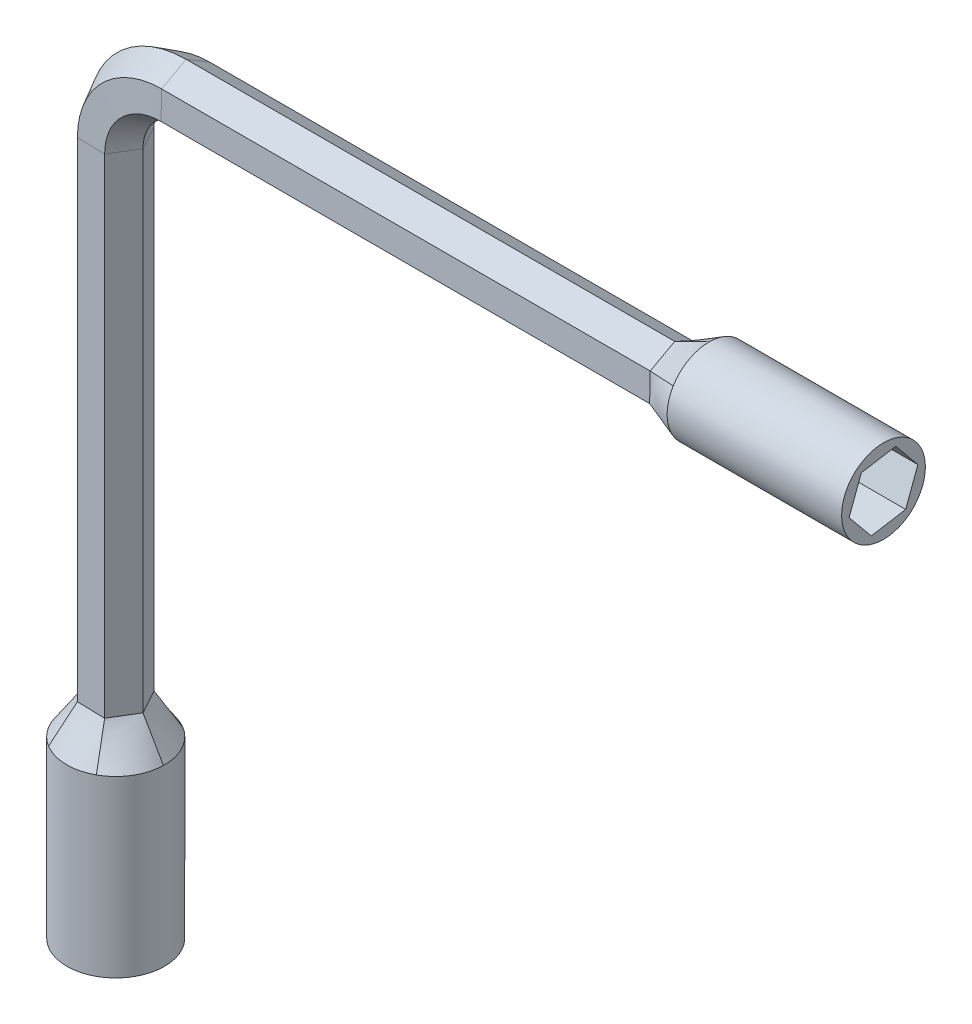
from build123d import *

# Parameters (mm, degrees)
SZKIC11_R                   = 6
DODANIE_WYCI_GNI_CIE2_DEPTH = 25
WYTNIJ_WYCI_GNI_CIE1_DEPTH  = 20
SZKIC17_R                   = 7
DODANIE_WYCI_GNI_CIE4_DEPTH = 25
WYTNIJ_WYCI_GNI_CIE2_DEPTH  = 15


with BuildPart() as part:
    # Wyciągnięcie po ścieżce3: sweep along a path in Szkic1
    with BuildLine(Plane.XY) as wyci_gni_cie_po_cie_ce3_path:
        Line((0, 0), (0, 70))
        ThreePointArc((0, 70), (2.928932188, 77.071067812), (10, 80))
        Line((10, 80), (80, 80))
    # Szkic3 → Wyciągnięcie po ścieżce3 (sweep)
    with BuildSketch(Plane(origin=(0, 0, 0), x_dir=(1, 0, 0), z_dir=(0, 1, 0))):
        Polygon((-1.921988676, 3.50798511), (-3.998998559, 0.089501536), (-2.077009883, -3.418483574), (1.921988676, -3.50798511), (3.998998559, -0.089501536), (2.077009883, 3.418483574), align=None)
    sweep(path=wyci_gni_cie_po_cie_ce3_path.line)

    # Wyciągnięcie po profilach3: read off the stored shape, not the designer's step
    # Wyciągnięcie po profilach3: loft between two sections, ruled curve by curve
    wyci_gni_cie_po_profilach3_from = [
        Edge.make_bspline([(80, 81.921988676, -3.50798511), (80, 82.095072833, -3.223111478), (80, 82.26815699, -2.938237847), (80, 82.614325304, -2.368490585), (80, 82.787409461, -2.083616954), (80, 83.133577774, -1.513869691), (80, 83.306661931, -1.22899606), (80, 83.652830245, -0.659248798), (80, 83.825914402, -0.374375167), (80, 83.998998559, -0.089501536)], [0, 0, 0, 0, 0.25, 0.25, 0.5, 0.5, 0.75, 0.75, 1, 1, 1, 1], 3),
        Edge.make_bspline([(80, 83.998998559, -0.089501536), (80, 83.838832836, 0.202830557), (80, 83.678667113, 0.495162649), (80, 83.358335667, 1.079826834), (80, 83.198169944, 1.372158927), (80, 82.877838498, 1.956823112), (80, 82.717672775, 2.249155204), (80, 82.397341329, 2.833819389), (80, 82.237175606, 3.126151482), (80, 82.077009883, 3.418483574)], [0, 0, 0, 0, 0.25, 0.25, 0.5, 0.5, 0.75, 0.75, 1, 1, 1, 1], 3),
        Edge.make_bspline([(80, 77.922990117, -3.418483574), (80, 78.256239997, -3.425942035), (80, 78.589489877, -3.433400497), (80, 79.255989637, -3.448317419), (80, 79.589239517, -3.455775881), (80, 80.255739276, -3.470692803), (80, 80.588989156, -3.478151264), (80, 81.255488916, -3.493068187), (80, 81.588738796, -3.500526648), (80, 81.921988676, -3.50798511)], [0, 0, 0, 0, 0.25, 0.25, 0.5, 0.5, 0.75, 0.75, 1, 1, 1, 1], 3),
        Edge.make_bspline([(80, 82.077009883, 3.418483574), (80, 81.743760003, 3.425942035), (80, 81.410510123, 3.433400497), (80, 80.744010363, 3.448317419), (80, 80.410760483, 3.455775881), (80, 79.744260724, 3.470692803), (80, 79.411010844, 3.478151264), (80, 78.744511084, 3.493068187), (80, 78.411261204, 3.500526648), (80, 78.078011324, 3.50798511)], [0, 0, 0, 0, 0.25, 0.25, 0.5, 0.5, 0.75, 0.75, 1, 1, 1, 1], 3),
        Edge.make_bspline([(80, 78.078011324, 3.50798511), (80, 77.904927167, 3.223111478), (80, 77.73184301, 2.938237847), (80, 77.385674696, 2.368490585), (80, 77.212590539, 2.083616954), (80, 76.866422226, 1.513869691), (80, 76.693338069, 1.22899606), (80, 76.347169755, 0.659248798), (80, 76.174085598, 0.374375167), (80, 76.001001441, 0.089501536)], [0, 0, 0, 0, 0.25, 0.25, 0.5, 0.5, 0.75, 0.75, 1, 1, 1, 1], 3),
        Edge.make_bspline([(80, 76.001001441, 0.089501536), (80, 76.161167164, -0.202830557), (80, 76.321332887, -0.495162649), (80, 76.641664333, -1.079826834), (80, 76.801830056, -1.372158927), (80, 77.122161502, -1.956823112), (80, 77.282327225, -2.249155204), (80, 77.602658671, -2.833819389), (80, 77.762824394, -3.126151482), (80, 77.922990117, -3.418483574)], [0, 0, 0, 0, 0.25, 0.25, 0.5, 0.5, 0.75, 0.75, 1, 1, 1, 1], 3),
    ]
    wyci_gni_cie_po_profilach3_to = [
        Edge.make_bspline([(85, 83.349344408, -5.261977664), (85, 83.787842547, -5.02172908), (85, 84.211027249, -4.717480921), (85, 84.975323877, -3.993295122), (85, 85.315820195, -3.573504781), (85, 85.872353316, -2.657524868), (85, 86.088044053, -2.161904874), (85, 86.37862671, -1.149898883), (85, 86.453671541, -0.634127123), (85, 86.464859233, -0.134252303)], [0, 0, 0, 0, 0.25, 0.25, 0.5, 0.5, 0.75, 0.75, 1, 1, 1, 1], 3),
        Edge.make_bspline([(85, 86.464859233, -0.134252303), (85, 86.476046925, 0.365622516), (85, 86.424152641, 0.884235299), (85, 86.179137656, 1.908228494), (85, 85.985836715, 2.413002125), (85, 85.470841402, 3.352963903), (85, 85.149467265, 3.787567557), (85, 84.418335696, 4.545222516), (85, 84.009186666, 4.868099126), (85, 83.581876219, 5.127725361)], [0, 0, 0, 0, 0.25, 0.25, 0.5, 0.5, 0.75, 0.75, 1, 1, 1, 1], 3),
        Edge.make_bspline([(85, 77.35084657, -5.127725361), (85, 77.778157016, -5.387351596), (85, 78.253236002, -5.601716219), (85, 79.262547615, -5.901523616), (85, 79.796344874, -5.986506906), (85, 80.867873308, -6.010488771), (85, 81.404938182, -5.949472432), (85, 82.426652408, -5.695121399), (85, 82.91084627, -5.502226249), (85, 83.349344408, -5.261977664)], [0, 0, 0, 0, 0.25, 0.25, 0.5, 0.5, 0.75, 0.75, 1, 1, 1, 1], 3),
        Edge.make_bspline([(85, 83.581876219, 5.127725361), (85, 83.154565772, 5.387351596), (85, 82.679486786, 5.601716219), (85, 81.670175173, 5.901523616), (85, 81.136377915, 5.986506906), (85, 80.06484948, 6.010488771), (85, 79.527784606, 5.949472432), (85, 78.506070381, 5.695121399), (85, 78.021876519, 5.502226249), (85, 77.58337838, 5.261977664)], [0, 0, 0, 0, 0.25, 0.25, 0.5, 0.5, 0.75, 0.75, 1, 1, 1, 1], 3),
        Edge.make_bspline([(85, 77.58337838, 5.261977664), (85, 77.144880242, 5.02172908), (85, 76.721695539, 4.717480921), (85, 75.957398911, 3.993295122), (85, 75.616902594, 3.573504781), (85, 75.060369473, 2.657524868), (85, 74.844678735, 2.161904874), (85, 74.554096079, 1.149898883), (85, 74.479051248, 0.634127123), (85, 74.467863556, 0.134252303)], [0, 0, 0, 0, 0.25, 0.25, 0.5, 0.5, 0.75, 0.75, 1, 1, 1, 1], 3),
        Edge.make_bspline([(85, 74.467863556, 0.134252303), (85, 74.456675864, -0.365622516), (85, 74.508570148, -0.884235299), (85, 74.753585133, -1.908228494), (85, 74.946886073, -2.413002125), (85, 75.461881387, -3.352963903), (85, 75.783255523, -3.787567557), (85, 76.514387092, -4.545222516), (85, 76.923536123, -4.868099126), (85, 77.35084657, -5.127725361)], [0, 0, 0, 0, 0.25, 0.25, 0.5, 0.5, 0.75, 0.75, 1, 1, 1, 1], 3),
    ]
    wyci_gni_cie_po_profilach3 = Solid(Shell([*[Face.make_surface_from_curves(wyci_gni_cie_po_profilach3_from[k], wyci_gni_cie_po_profilach3_to[k]) for k in range(6)], Face(Wire(wyci_gni_cie_po_profilach3_from)), Face(Wire(wyci_gni_cie_po_profilach3_to))]))
    add(wyci_gni_cie_po_profilach3)

    # Szkic11 → Dodanie-wyciągnięcie2 (add)
    with BuildSketch(Plane(origin=(85, 0, 0), x_dir=(0, 0, -1), z_dir=(1, 0, 0))):
        with Locations(Location((0, 80.466361394, 0), (0, 0, 208.71786867))):
            Circle(SZKIC11_R)
    extrude(amount=DODANIE_WYCI_GNI_CIE2_DEPTH)

    # Szkic12 → Wytnij-wyciągnięcie1 (cut)
    with BuildSketch(Plane(origin=(110, 0, 0), x_dir=(0, 0, -1), z_dir=(1, 0, 0))):
        Polygon((-3.178664822, 84.325906698), (-4.931796691, 79.643329561), (-1.753131869, 75.783784257), (3.178664822, 76.60681609), (4.931796691, 81.289393228), (1.753131869, 85.148938532), align=None)
    extrude(amount=-WYTNIJ_WYCI_GNI_CIE1_DEPTH, mode=Mode.SUBTRACT)

    # Wyciągnięcie po profilach4: read off the stored shape, not the designer's step
    # Wyciągnięcie po profilach4: loft between two sections, ruled curve by curve
    wyci_gni_cie_po_profilach4_from = [
        Edge.make_bspline([(3.998998559, 0, 0.089501536), (3.825914402, 0, 0.374375167), (3.652830245, 0, 0.659248798), (3.306661931, 0, 1.22899606), (3.133577774, 0, 1.513869691), (2.787409461, 0, 2.083616954), (2.614325304, 0, 2.368490585), (2.26815699, 0, 2.938237847), (2.095072833, 0, 3.223111478), (1.921988676, 0, 3.50798511)], [0, 0, 0, 0, 0.25, 0.25, 0.5, 0.5, 0.75, 0.75, 1, 1, 1, 1], 3),
        Edge.make_bspline([(1.921988676, 0, 3.50798511), (1.588738796, 0, 3.500526648), (1.255488916, 0, 3.493068187), (0.588989156, 0, 3.478151264), (0.255739276, 0, 3.470692803), (-0.410760483, 0, 3.455775881), (-0.744010363, 0, 3.448317419), (-1.410510123, 0, 3.433400497), (-1.743760003, 0, 3.425942035), (-2.077009883, 0, 3.418483574)], [0, 0, 0, 0, 0.25, 0.25, 0.5, 0.5, 0.75, 0.75, 1, 1, 1, 1], 3),
        Edge.make_bspline([(2.077009883, 0, -3.418483574), (2.237175606, 0, -3.126151482), (2.397341329, 0, -2.833819389), (2.717672775, 0, -2.249155204), (2.877838498, 0, -1.956823112), (3.198169944, 0, -1.372158927), (3.358335667, 0, -1.079826834), (3.678667113, 0, -0.495162649), (3.838832836, 0, -0.202830557), (3.998998559, 0, 0.089501536)], [0, 0, 0, 0, 0.25, 0.25, 0.5, 0.5, 0.75, 0.75, 1, 1, 1, 1], 3),
        Edge.make_bspline([(-2.077009883, 0, 3.418483574), (-2.237175606, 0, 3.126151482), (-2.397341329, 0, 2.833819389), (-2.717672775, 0, 2.249155204), (-2.877838498, 0, 1.956823112), (-3.198169944, 0, 1.372158927), (-3.358335667, 0, 1.079826834), (-3.678667113, 0, 0.495162649), (-3.838832836, 0, 0.202830557), (-3.998998559, 0, -0.089501536)], [0, 0, 0, 0, 0.25, 0.25, 0.5, 0.5, 0.75, 0.75, 1, 1, 1, 1], 3),
        Edge.make_bspline([(-3.998998559, 0, -0.089501536), (-3.825914402, 0, -0.374375167), (-3.652830245, 0, -0.659248798), (-3.306661931, 0, -1.22899606), (-3.133577774, 0, -1.513869691), (-2.787409461, 0, -2.083616954), (-2.614325304, 0, -2.368490585), (-2.26815699, 0, -2.938237847), (-2.095072833, 0, -3.223111478), (-1.921988676, 0, -3.50798511)], [0, 0, 0, 0, 0.25, 0.25, 0.5, 0.5, 0.75, 0.75, 1, 1, 1, 1], 3),
        Edge.make_bspline([(-1.921988676, 0, -3.50798511), (-1.588738796, 0, -3.500526648), (-1.255488916, 0, -3.493068187), (-0.588989156, 0, -3.478151264), (-0.255739276, 0, -3.470692803), (0.410760483, 0, -3.455775881), (0.744010363, 0, -3.448317419), (1.410510123, 0, -3.433400497), (1.743760003, 0, -3.425942035), (2.077009883, 0, -3.418483574)], [0, 0, 0, 0, 0.25, 0.25, 0.5, 0.5, 0.75, 0.75, 1, 1, 1, 1], 3),
    ]
    wyci_gni_cie_po_profilach4_to = [
        Edge.make_bspline([(6.998247478, -5, 0.156627687), (6.985195171, -5, 0.739814977), (6.897642868, -5, 1.341548697), (6.558629769, -5, 2.522222353), (6.306990575, -5, 3.100445679), (5.657701934, -5, 4.169088911), (5.26045623, -5, 4.658844309), (4.368776831, -5, 5.503727741), (3.875061345, -5, 5.858683927), (3.363480183, -5, 6.138973942)], [0, 0, 0, 0, 0.25, 0.25, 0.5, 0.5, 0.75, 0.75, 1, 1, 1, 1], 3),
        Edge.make_bspline([(3.363480183, -5, 6.138973942), (2.851899021, -5, 6.419263957), (2.287006182, -5, 6.644308298), (1.095006252, -5, 6.94105117), (0.468430566, -5, 7.012236899), (-0.781685941, -5, 6.984258058), (-1.404449409, -5, 6.885110885), (-2.581979624, -5, 6.535335589), (-3.136238441, -5, 6.285243529), (-3.634767295, -5, 5.982346255)], [0, 0, 0, 0, 0.25, 0.25, 0.5, 0.5, 0.75, 0.75, 1, 1, 1, 1], 3),
        Edge.make_bspline([(3.634767295, -5, -5.982346255), (4.13329615, -5, -5.67944898), (4.610636686, -5, -5.302759602), (5.463623516, -5, -4.418828817), (5.838560009, -5, -3.91179122), (6.439387875, -5, -2.815169146), (6.664905639, -5, -2.226266576), (6.950756454, -5, -1.031607848), (7.011299786, -5, -0.426559603), (6.998247478, -5, 0.156627687)], [0, 0, 0, 0, 0.25, 0.25, 0.5, 0.5, 0.75, 0.75, 1, 1, 1, 1], 3),
        Edge.make_bspline([(-3.634767295, -5, 5.982346255), (-4.13329615, -5, 5.67944898), (-4.610636686, -5, 5.302759602), (-5.463623516, -5, 4.418828817), (-5.838560009, -5, 3.91179122), (-6.439387875, -5, 2.815169146), (-6.664905639, -5, 2.226266576), (-6.950756454, -5, 1.031607848), (-7.011299786, -5, 0.426559603), (-6.998247478, -5, -0.156627687)], [0, 0, 0, 0, 0.25, 0.25, 0.5, 0.5, 0.75, 0.75, 1, 1, 1, 1], 3),
        Edge.make_bspline([(-6.998247478, -5, -0.156627687), (-6.985195171, -5, -0.739814977), (-6.897642868, -5, -1.341548697), (-6.558629769, -5, -2.522222353), (-6.306990575, -5, -3.100445679), (-5.657701934, -5, -4.169088911), (-5.26045623, -5, -4.658844309), (-4.368776831, -5, -5.503727741), (-3.875061345, -5, -5.858683927), (-3.363480183, -5, -6.138973942)], [0, 0, 0, 0, 0.25, 0.25, 0.5, 0.5, 0.75, 0.75, 1, 1, 1, 1], 3),
        Edge.make_bspline([(-3.363480183, -5, -6.138973942), (-2.851899021, -5, -6.419263957), (-2.287006182, -5, -6.644308298), (-1.095006252, -5, -6.94105117), (-0.468430566, -5, -7.012236899), (0.781685941, -5, -6.984258058), (1.404449409, -5, -6.885110885), (2.581979624, -5, -6.535335589), (3.136238441, -5, -6.285243529), (3.634767295, -5, -5.982346255)], [0, 0, 0, 0, 0.25, 0.25, 0.5, 0.5, 0.75, 0.75, 1, 1, 1, 1], 3),
    ]
    wyci_gni_cie_po_profilach4 = Solid(Shell([*[Face.make_surface_from_curves(wyci_gni_cie_po_profilach4_from[k], wyci_gni_cie_po_profilach4_to[k]) for k in range(6)], Face(Wire(wyci_gni_cie_po_profilach4_from)), Face(Wire(wyci_gni_cie_po_profilach4_to))]))
    add(wyci_gni_cie_po_profilach4)

    # Szkic17 → Dodanie-wyciągnięcie4 (add)
    with BuildSketch(Plane(origin=(0, -5, 0), x_dir=(-1, 0, 0), z_dir=(0, -1, 0))):
        with Locations(Location((0, 0, 0), (0, 0, 241.282131678))):
            Circle(SZKIC17_R)
    extrude(amount=DODANIE_WYCI_GNI_CIE4_DEPTH)

    # Szkic18 → Wytnij-wyciągnięcie2 (cut)
    with BuildSketch(Plane.XZ.offset(30)):
        Polygon((-4.239384903, 4.245893974), (-5.796744495, -1.548468036), (-1.557359592, -5.79436201), (4.239384903, -4.245893974), (5.796744495, 1.548468036), (1.557359592, 5.79436201), align=None)
    extrude(amount=-WYTNIJ_WYCI_GNI_CIE2_DEPTH, mode=Mode.SUBTRACT)


solid = part.part
